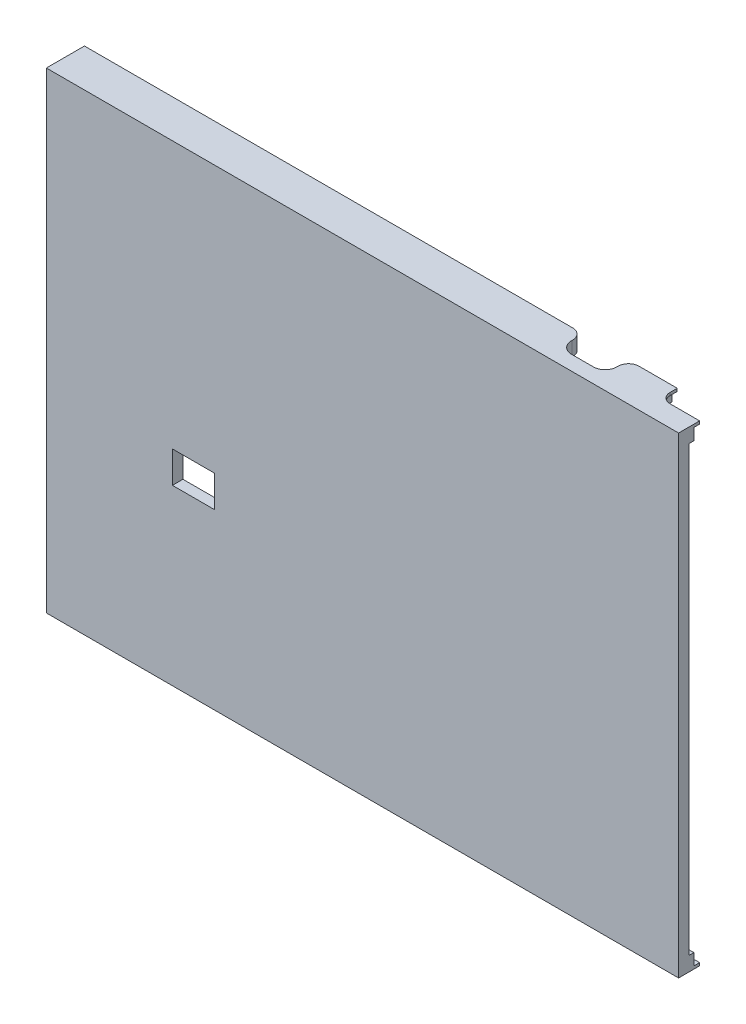
from build123d import *

# Parameters (mm, degrees)
BOSS_EXTRUDE1_START     = 3.25
BOSS_EXTRUDE1_OUTLINE_W = 176
BOSS_EXTRUDE1_OUTLINE_H = 126
BOSS_EXTRUDE1_DEPTH     = 6
BOSS_EXTRUDE2_DEPTH     = 3.3
BOSS_EXTRUDE4_DEPTH     = 1
SKETCH7_W               = 12.05
SKETCH7_H               = 9
CUT_EXTRUDE1_DEPTH      = 6
BOSS_EXTRUDE5_DEPTH     = 3.3
BOSS_EXTRUDE7_DEPTH     = 1
BOSS_EXTRUDE8_START     = 2.6
BOSS_EXTRUDE8_DEPTH     = 2.6
BOSS_EXTRUDE9_START     = 0.7
BOSS_EXTRUDE9_DEPTH     = 0.7
BOSS_EXTRUDE10_START    = 1
BOSS_EXTRUDE10_DEPTH    = 1
SKETCH14_W              = 12.7
SKETCH14_H              = 3.5
SKETCH14_W_2            = 3.5
SKETCH14_H_2            = 25.4
CUT_EXTRUDE2_DEPTH      = 6.5116
CUT_EXTRUDE3_REACH      = 194.673
SKETCH15_R              = 4
CUT_EXTRUDE4_DEPTH      = 4.3
FILLET1_R               = 3
CUT_EXTRUDE5_START      = -4.8616
CUT_EXTRUDE5_DEPTH      = 4.8616
SKETCH19_W              = 176.2
SKETCH19_H              = 126.4
CUT_EXTRUDE6_DEPTH      = 3
SKETCH16_R              = 4
SKETCH16_R_2            = 2.1
BOSS_EXTRUDE11_DEPTH    = 4.25
SKETCH20_W              = 129.139207087
SKETCH20_H              = 3
SKETCH20_W_2            = 9.439207087
SKETCH20_W_3            = 158.5
BOSS_EXTRUDE12_DEPTH    = 4.25


# Read off the part's stored shape, not the designer's step: Boss-Extrude1, Cut-Extrude5
with BuildPart() as part:
    # Boss-Extrude1 outline → Boss-Extrude1 (new body)
    with BuildSketch(Plane.XY.offset(BOSS_EXTRUDE1_START)):
        with Locations((-88, 0)):
            Rectangle(BOSS_EXTRUDE1_OUTLINE_W, BOSS_EXTRUDE1_OUTLINE_H)
    extrude(amount=BOSS_EXTRUDE1_DEPTH)

    # Sketch3 → Boss-Extrude2 (add)
    with BuildSketch(Plane.ZY.offset(176)):
        with BuildLine():
            Line((9.25, -63), (9.25, 63))
            Line((9.25, 63), (-1.6116, 63))
            Line((-1.6116, 63), (-1.6116, 12.5))
            Line((-1.6116, 12.5), (0.4, 12.5))
            ThreePointArc((0.4, 12.5), (3.228427125, 11.328427125), (4.4, 8.5))
            Line((4.4, 8.5), (4.4, -8.5))
            ThreePointArc((4.4, -8.5), (3.228427125, -11.328427125), (0.4, -12.5))
            Line((0.4, -12.5), (-1.6116, -12.5))
            Line((-1.6116, -12.5), (-1.6116, -63))
            Line((-1.6116, -63), (9.25, -63))
        make_face()
    extrude(amount=BOSS_EXTRUDE2_DEPTH)

    # Sketch6 → Boss-Extrude4 (add)
    with BuildSketch(Plane.ZY.offset(179.3)):
        with BuildLine():
            Line((9.25, -63), (9.25, 63))
            Line((9.25, 63), (-1.6116, 63))
            Line((-1.6116, 63), (-1.6116, 11.25))
            Line((-1.6116, 11.25), (0.4, 11.25))
            ThreePointArc((0.4, 11.25), (2.415254326, 10.415254326), (3.25, 8.4))
            Line((3.25, 8.4), (3.25, -8.4))
            ThreePointArc((3.25, -8.4), (2.415254326, -10.415254326), (0.4, -11.25))
            Line((0.4, -11.25), (-1.6116, -11.25))
            Line((-1.6116, -11.25), (-1.6116, -63))
            Line((-1.6116, -63), (9.25, -63))
        make_face()
    extrude(amount=BOSS_EXTRUDE4_DEPTH)

    # Sketch7 → Cut-Extrude1 (cut)
    with BuildSketch(Plane(origin=(0, 0, 3.25), x_dir=(-1, 0, 0), z_dir=(0, 0, -1))):
        with Locations((138.325, -13.3)):
            Rectangle(SKETCH7_W, SKETCH7_H)
    extrude(amount=-CUT_EXTRUDE1_DEPTH, mode=Mode.SUBTRACT)

    # Sketch8 → Boss-Extrude5 (add)
    with BuildSketch(Plane.XZ.offset(63)):
        with BuildLine():
            Line((0, 9.25), (-180.3, 9.25))
            Line((-180.3, 9.25), (-180.3, -1.6116))
            Line((-180.3, -1.6116), (-11.957378406, -1.6116))
            ThreePointArc((-11.957378406, -1.6116), (-11.96744863, 2.394191566), (-8.5, 4.4))
            Line((-8.5, 4.4), (0, 4.4))
            Line((0, 4.4), (0, 9.25))
        make_face()
    extrude(amount=BOSS_EXTRUDE5_DEPTH)

    # Sketch10 → Boss-Extrude7 (add)
    with BuildSketch(Plane.XZ.offset(66.3)):
        with BuildLine():
            Line((0, 9.25), (-180.3, 9.25))
            Line((-180.3, 9.25), (-180.3, -1.6116))
            Line((-180.3, -1.6116), (-11.25, -1.6116))
            Line((-11.25, -1.6116), (-11.25, 0.4))
            ThreePointArc((-11.25, 0.4), (-10.415254326, 2.415254326), (-8.4, 3.25))
            Line((-8.4, 3.25), (0, 3.25))
            Line((0, 3.25), (0, 9.25))
        make_face()
    extrude(amount=BOSS_EXTRUDE7_DEPTH)

    # Sketch11 → Boss-Extrude8 (add)
    with BuildSketch(Plane(origin=(0, 63, 0), x_dir=(1, 0, 0), z_dir=(0, 1, 0)).offset(BOSS_EXTRUDE8_START)):
        with BuildLine():
            Line((-180.3, -9.25), (0, -9.25))
            Line((0, -9.25), (0, -4.4))
            Line((0, -4.4), (-8.5, -4.4))
            ThreePointArc((-8.5, -4.4), (-11.96744863, -2.394191566), (-11.957378406, 1.6116))
            Line((-11.957378406, 1.6116), (-180.3, 1.6116))
            Line((-180.3, 1.6116), (-180.3, -9.25))
        make_face()
    extrude(amount=-BOSS_EXTRUDE8_DEPTH)

    # Sketch12 → Boss-Extrude9 (add)
    with BuildSketch(Plane(origin=(0, 65.6, 0), x_dir=(1, 0, 0), z_dir=(0, 1, 0)).offset(BOSS_EXTRUDE9_START)):
        with BuildLine():
            Line((-180.3, -9.25), (0, -9.25))
            Line((0, -9.25), (0, -4.4))
            Line((0, -4.4), (-8.5, -4.4))
            ThreePointArc((-8.5, -4.4), (-11.96744863, -2.394191566), (-11.957378406, 1.6116))
            Line((-11.957378406, 1.6116), (-180.3, 1.6116))
            Line((-180.3, 1.6116), (-180.3, -9.25))
        make_face()
    extrude(amount=-BOSS_EXTRUDE9_DEPTH)

    # Sketch13 → Boss-Extrude10 (add)
    with BuildSketch(Plane(origin=(0, 66.3, 0), x_dir=(1, 0, 0), z_dir=(0, 1, 0)).offset(BOSS_EXTRUDE10_START)):
        with BuildLine():
            Line((-180.3, -9.25), (0, -9.25))
            Line((0, -9.25), (0, -3.25))
            Line((0, -3.25), (-8.4, -3.25))
            ThreePointArc((-8.4, -3.25), (-10.415254326, -2.415254326), (-11.25, -0.4))
            Line((-11.25, -0.4), (-11.25, 1.6116))
            Line((-11.25, 1.6116), (-180.3, 1.6116))
            Line((-180.3, 1.6116), (-180.3, -9.25))
        make_face()
    extrude(amount=-BOSS_EXTRUDE10_DEPTH)

    # Sketch14 → Cut-Extrude2 (cut)
    with BuildSketch(Plane(origin=(0, 0, -1.6116), x_dir=(-1, 0, 0), z_dir=(0, 0, -1))):
        with Locations((6.35, 64.75)):
            Rectangle(SKETCH14_W, SKETCH14_H)
        with Locations((177.75, 0)):
            Rectangle(SKETCH14_W_2, SKETCH14_H_2)
        with Locations((6.35, -64.75)):
            Rectangle(SKETCH14_W, SKETCH14_H)
    extrude(amount=-CUT_EXTRUDE2_DEPTH, mode=Mode.SUBTRACT)

    # Sketch15 → Cut-Extrude3 (cut, up to next)
    with BuildSketch(Plane.ZY.offset(180.3), mode=Mode.PRIVATE) as cut_extrude3_sk1:
        with Locations((-3.6116, -37.125)):
            Circle(SKETCH15_R)
    cut_extrude3_tool1 = extrude(cut_extrude3_sk1.sketch, amount=-CUT_EXTRUDE3_REACH, mode=Mode.PRIVATE) & part.part
    add(cut_extrude3_tool1.solids().sort_by_distance((-180.3, -37.125, -3.6116))[0], mode=Mode.SUBTRACT)

    # Sketch17 → Cut-Extrude4 (cut)
    with BuildSketch(Plane(origin=(0, 67.3, 0), x_dir=(1, 0, 0), z_dir=(0, 1, 0))):
        with BuildLine():
            Line((-28.4716, -5.0716), (-34.7284, -5.0716))
            ThreePointArc((-34.7284, -5.0716), (-38.07, -1.73), (-34.7284, 1.6116))
            Line((-34.7284, 1.6116), (-28.4716, 1.6116))
            ThreePointArc((-28.4716, 1.6116), (-25.13, -1.73), (-28.4716, -5.0716))
        make_face()
    extrude(amount=-CUT_EXTRUDE4_DEPTH, mode=Mode.SUBTRACT)

    # Fillet1
    fillet1_edges = [part.edges().sort_by_distance(p)[0] for p in [
        (-34.7284, 65.15, -1.6116),
    ]]
    fillet(fillet1_edges, radius=FILLET1_R)
    fillet1_2_edges = [part.edges().sort_by_distance(p)[0] for p in [
        (-28.4716, 65.15, -1.6116),
    ]]
    fillet(fillet1_2_edges, radius=FILLET1_R)

    # Cut-Extrude5 outline → Cut-Extrude5 (cut)
    with BuildSketch(Plane(origin=(0, 0, -1.6116), x_dir=(-1, 0, 0), z_dir=(0, 0, -1)).offset(CUT_EXTRUDE5_START)):
        Polygon((176, 63), (176, -63), (0, -63), (0, -63.2), (176.2, -63.2), (176.2, 63.2), (0, 63.2), (0, 63), align=None)
    extrude(amount=CUT_EXTRUDE5_DEPTH, mode=Mode.SUBTRACT)

    # Sketch19 → Cut-Extrude6 (cut)
    with BuildSketch(Plane(origin=(0, 0, 3.25), x_dir=(-1, 0, 0), z_dir=(0, 0, -1))):
        with Locations((88.1, 0)):
            Rectangle(SKETCH19_W, SKETCH19_H)
    extrude(amount=-CUT_EXTRUDE6_DEPTH, mode=Mode.SUBTRACT)

    # Sketch16 → Boss-Extrude11 (add)
    # profile 1 of 3: a face of its own
    with BuildSketch(Plane(origin=(0, 0, 6.25), x_dir=(-1, 0, 0), z_dir=(0, 0, -1))):
        with Locations(Location((156.5, 38, 0), (0, 0, 270))):
            Circle(SKETCH16_R)
        with Locations((156.5, 38)):
            Circle(SKETCH16_R_2, mode=Mode.SUBTRACT)
    # profile 2 of 3: a face of its own
    with BuildSketch(Plane(origin=(0, 0, 6.25), x_dir=(-1, 0, 0), z_dir=(0, 0, -1))):
        with Locations(Location((23.5, 38, 0), (0, 0, 270))):
            Circle(SKETCH16_R)
        with Locations((23.5, 38)):
            Circle(SKETCH16_R_2, mode=Mode.SUBTRACT)
    # profile 3 of 3: a face of its own
    with BuildSketch(Plane(origin=(0, 0, 6.25), x_dir=(-1, 0, 0), z_dir=(0, 0, -1))):
        with Locations(Location((123.5, -32, 0), (0, 0, 270))):
            Circle(SKETCH16_R)
        with Locations((123.5, -32)):
            Circle(SKETCH16_R_2, mode=Mode.SUBTRACT)
    extrude(amount=BOSS_EXTRUDE11_DEPTH)

    # Sketch20 → Boss-Extrude12 (add)
    with BuildSketch(Plane(origin=(0, 0, 6.25), x_dir=(-1, 0, 0), z_dir=(0, 0, -1))):
        with Locations((108.630396457, 61.7)):
            Rectangle(SKETCH20_W, SKETCH20_H)
        with Locations((17.419603544, 61.7)):
            Rectangle(SKETCH20_W_2, SKETCH20_H)
        Polygon((173.2, 17.7), (176.2, 17.7), (176.2, 63.2), (173.2, 63.2), (173.2, 60.2), align=None)
        with Locations((96.95, -61.7)):
            Rectangle(SKETCH20_W_3, SKETCH20_H)
    extrude(amount=BOSS_EXTRUDE12_DEPTH)


solid = part.part
